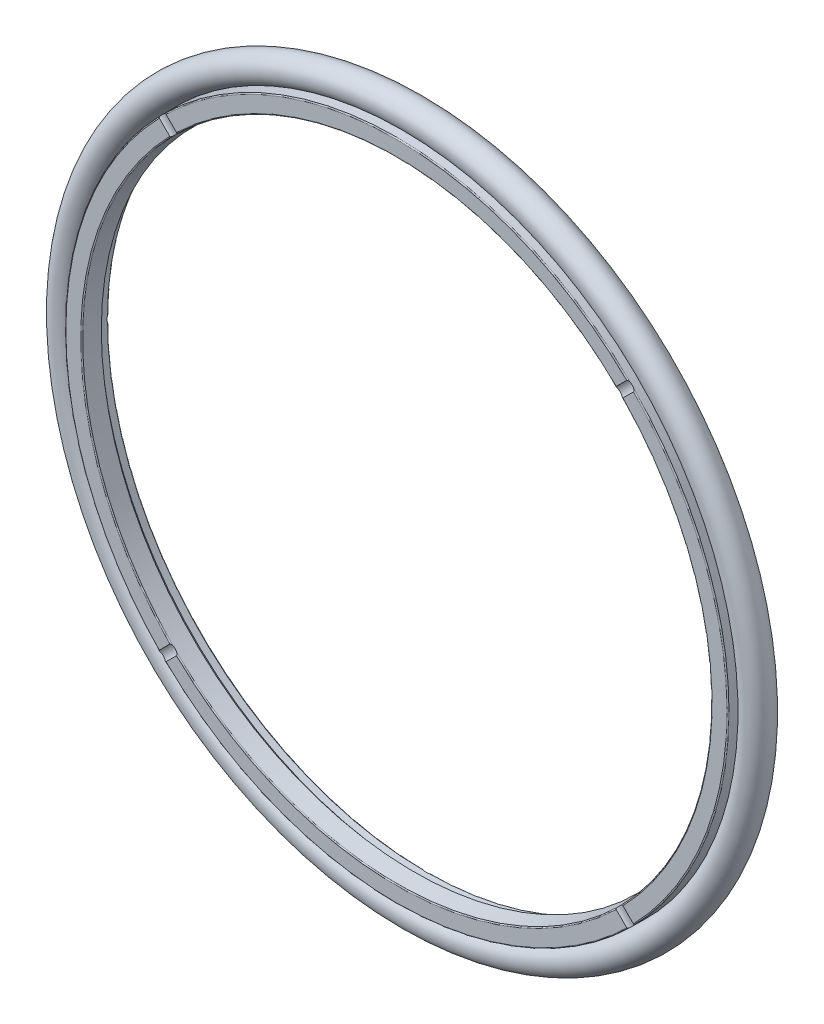
from build123d import *

# Parameters (mm, degrees)
SKETCH4_R          = 2.665
CUT_EXTRUDE1_DEPTH = 98.077355637
CIRPATTERN1_COUNT  = 4
CUT_EXTRUDE2_DEPTH = 98.077355637
CIRPATTERN2_COUNT  = 4


with BuildPart() as part:
    # Sketch1 → Revolve1 (revolve)
    with BuildSketch(Plane(origin=(0, 0, 0), x_dir=(0, 0, -1), z_dir=(1, 0, 0))):
        with BuildLine():
            Line((0, 61), (0, 62.95))
            ThreePointArc((0, 62.95), (-0.058578644, 63.091421356), (-0.2, 63.15))
            Line((-0.2, 63.15), (-5.75, 63.15))
            ThreePointArc((-5.75, 63.15), (-5.891421356, 63.091421356), (-5.95, 62.95))
            Line((-5.95, 62.95), (-5.95, 60.133363415))
            ThreePointArc((-5.95, 60.133363415), (-5.897419783, 59.998206441), (-5.767325923, 59.934115298))
            Line((-5.767325923, 59.934115298), (-2.5, 59.65))
            Line((-2.5, 59.65), (-1.5, 60.8))
            Line((-1.5, 60.8), (-0.2, 60.8))
            ThreePointArc((-0.2, 60.8), (-0.058578644, 60.858578644), (0, 61))
        make_face()
    revolve(axis=Axis((0, 0, 0), (0, 0, 1)))

    # Sketch2 → Cut-Extrude1 (cut, symmetric)
    with BuildSketch(Plane(origin=(0, 0, 0), x_dir=(0, 0, -1), z_dir=(1, 0, 0))):
        with BuildLine():
            Line((0, 0.9), (0, -0.9))
            ThreePointArc((0, -0.9), (-0.25, 0), (0, 0.9))
        make_face()
    cut_extrude1 = extrude(amount=CUT_EXTRUDE1_DEPTH, both=True, mode=Mode.SUBTRACT)

    # CirPattern1: Cut-Extrude1 ×4 about axis
    cirpattern1_axis = Axis((0, 0, 0), (0, 0, 1))
    for i in range(1, CIRPATTERN1_COUNT):
        add(cut_extrude1.rotate(cirpattern1_axis, i * 360 / CIRPATTERN1_COUNT), mode=Mode.SUBTRACT)

    # Sketch3 → Cut-Extrude2 (cut, symmetric)
    with BuildSketch(Plane(origin=(0, 0, 0), x_dir=(0.7071067811865488, 0.7071067811865462, 0), z_dir=(0.7071067811865462, -0.7071067811865488, 0))):
        with BuildLine():
            Line((-0.9, 5.95), (0.9, 5.95))
            ThreePointArc((0.9, 5.95), (0, 5.7), (-0.9, 5.95))
        make_face()
    cut_extrude2 = extrude(amount=CUT_EXTRUDE2_DEPTH, both=True, mode=Mode.SUBTRACT)

    # CirPattern2: Cut-Extrude2 ×4 about axis
    cirpattern2_axis = Axis((0, 0, 0), (0, 0, 1))
    for i in range(1, CIRPATTERN2_COUNT):
        add(cut_extrude2.rotate(cirpattern2_axis, i * 360 / CIRPATTERN2_COUNT), mode=Mode.SUBTRACT)


with BuildPart() as body_2:
    # Sketch4 → Revolve2 (revolve)
    with BuildSketch(Plane(origin=(0, 0, 0), x_dir=(0, 0, -1), z_dir=(1, 0, 0))):
        with Locations((-2.975, 65.85)):
            Circle(SKETCH4_R)
    revolve(axis=Axis((0, 0, 0), (0, 0, 1)))


solid = Compound([part.part, body_2.part])
